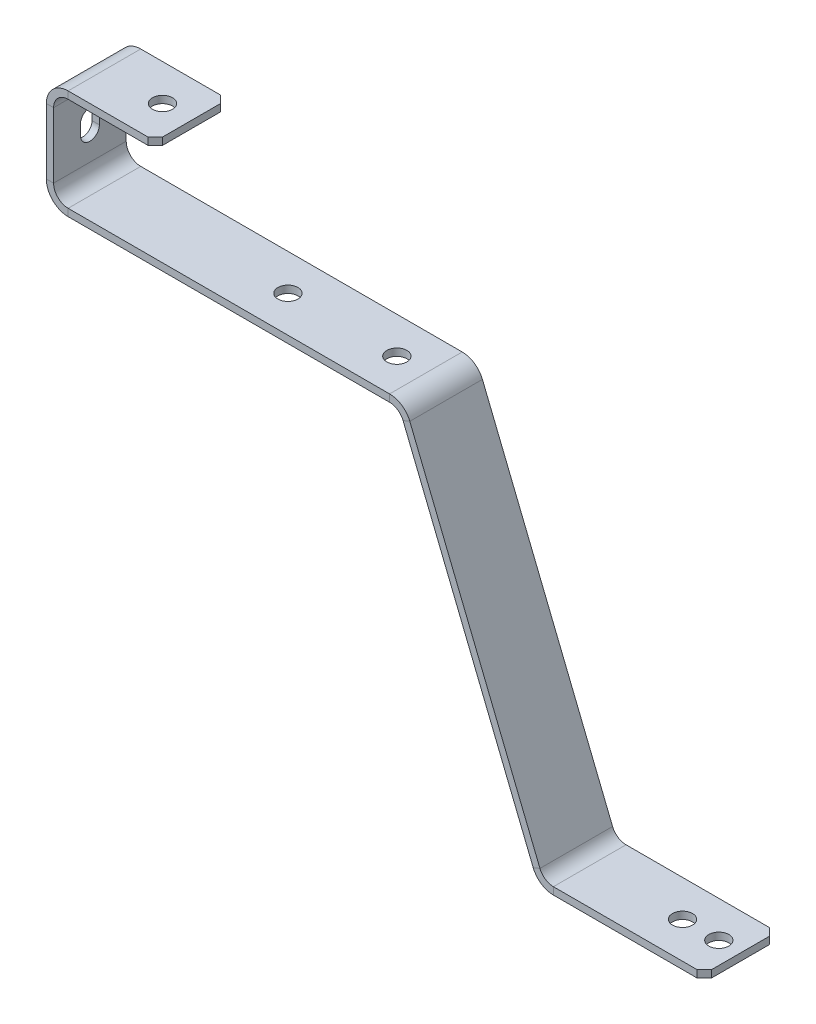
from build123d import *

# Parameters (mm, degrees)
SM_BASE_FLANGE_1_DEPTH = 50
SKETCH_3_R             = 6.9
CUT_EXTRUDE_2_DEPTH    = 10
OTHER_1_DEPTH          = 5
OTHER_START            = 307.42699492
OTHER_1_2_DEPTH        = 5
CUT_EXTRUDE_3_DEPTH    = 10
SKETCH_5_R             = 6.9
CUT_EXTRUDE_4_DEPTH    = 10
SKETCH_6_R             = 6.9
CUT_EXTRUDE_5_DEPTH    = 10


# Read off the part's stored shape, not the designer's step: Затупленный угол1
# Sheet-metal steps are written as plain solids
with BuildPart() as part:
    # Sketch 1 → Базовая кромка1 (new body)
    with BuildSketch(Plane.XY):
        with BuildLine():
            Line((-377.996732669, 312.42699492), (-437.996732669, 312.42699492))
            ThreePointArc((-437.996732669, 312.42699492), (-448.603334387, 308.033596638), (-452.996732669, 297.42699492))
            Line((-452.996732669, 297.42699492), (-452.996732669, 252.42699492))
            ThreePointArc((-452.996732669, 252.42699492), (-448.603334387, 241.820393202), (-437.996732669, 237.42699492))
            Line((-437.996732669, 237.42699492), (-216.671817837, 237.42699492))
            ThreePointArc((-216.671817837, 237.42699492), (-211.079888803, 235.717370646), (-207.399979292, 231.173060854))
            Line((-207.399979292, 231.173060854), (-117.790130066, 9.380901099))
            ThreePointArc((-117.790130066, 9.380901099), (-112.270265799, 2.564436412), (-103.882372247, 0))
            Line((-103.882372247, 0), (0, 0))
            Line((0, 0), (0, 5))
            Line((0, 5), (-103.882372247, 5))
            ThreePointArc((-103.882372247, 5), (-109.474301282, 6.709624274), (-113.154210793, 11.253934066))
            Line((-113.154210793, 11.253934066), (-202.764060019, 233.046093821))
            ThreePointArc((-202.764060019, 233.046093821), (-208.283924285, 239.862558508), (-216.671817837, 242.42699492))
            Line((-216.671817837, 242.42699492), (-437.996732669, 242.42699492))
            ThreePointArc((-437.996732669, 242.42699492), (-445.067800481, 245.355927108), (-447.996732669, 252.42699492))
            Line((-447.996732669, 252.42699492), (-447.996732669, 297.42699492))
            ThreePointArc((-447.996732669, 297.42699492), (-445.067800481, 304.498062732), (-437.996732669, 307.42699492))
            Line((-437.996732669, 307.42699492), (-377.996732669, 307.42699492))
            Line((-377.996732669, 307.42699492), (-377.996732669, 312.42699492))
        make_face()
    extrude(amount=SM_BASE_FLANGE_1_DEPTH)

    # Эскиз3 → Вырез-Вытянуть2 (cut)
    with BuildSketch(Plane(origin=(0, 5, 0), x_dir=(1, 0, 0), z_dir=(0, 1, 0))):
        with Locations(Location((-15, -25, 0), (0, 0, 270))):
            Circle(SKETCH_3_R)
        with Locations(Location((-40, -25, 0), (0, 0, 270))):
            Circle(SKETCH_3_R)
    extrude(amount=-CUT_EXTRUDE_2_DEPTH, mode=Mode.SUBTRACT)

    # Other 1 outline → Other 1 (cut)
    with BuildSketch(Plane(origin=(0, 0, 0), x_dir=(1, 0, 0), z_dir=(0, 1, 0))):
        Polygon((0, 0), (-5, 0), (0, -5), align=None)
        Polygon((0, -50), (0, -45), (-5, -50), align=None)
    extrude(amount=OTHER_1_DEPTH, mode=Mode.SUBTRACT)

    # Other 1 2 outline → Other 1 2 (cut)
    with BuildSketch(Plane(origin=(0, 0, 0), x_dir=(1, 0, 0), z_dir=(0, 1, 0)).offset(OTHER_START)):
        Polygon((-377.996732669, -50), (-377.996732669, -45), (-382.996732669, -50), align=None)
        Polygon((-382.996732669, 0), (-377.996732669, -5), (-377.996732669, 0), align=None)
    extrude(amount=OTHER_1_2_DEPTH, mode=Mode.SUBTRACT)

    # Эскиз4 → Вырез-Вытянуть3 (cut)
    with BuildSketch(Plane.ZY.offset(452.996732669)):
        with BuildLine():
            Line((18.5, 271.42699492), (18.5, 278.42699492))
            ThreePointArc((18.5, 278.42699492), (25, 284.92699492), (31.5, 278.42699492))
            Line((31.5, 278.42699492), (31.5, 271.42699492))
            ThreePointArc((31.5, 271.42699492), (25, 264.92699492), (18.5, 271.42699492))
        make_face()
    extrude(amount=-CUT_EXTRUDE_3_DEPTH, mode=Mode.SUBTRACT)

    # Эскиз5 → Вырез-Вытянуть4 (cut)
    with BuildSketch(Plane(origin=(0, 312.42699492, 0), x_dir=(1, 0, 0), z_dir=(0, 1, 0))):
        with Locations(Location((-397.996732669, -25, 0), (0, 0, 270))):
            Circle(SKETCH_5_R)
    extrude(amount=-CUT_EXTRUDE_4_DEPTH, mode=Mode.SUBTRACT)

    # Эскиз6 → Вырез-Вытянуть5 (cut)
    with BuildSketch(Plane(origin=(0, 242.42699492, 0), x_dir=(1, 0, 0), z_dir=(0, 1, 0))):
        with Locations(Location((-311.671817837, -25, 0), (0, 0, 180))):
            Circle(SKETCH_6_R)
        with Locations(Location((-236.671817837, -25, 0), (0, 0, 180))):
            Circle(SKETCH_6_R)
    extrude(amount=-CUT_EXTRUDE_5_DEPTH, mode=Mode.SUBTRACT)


solid = part.part
